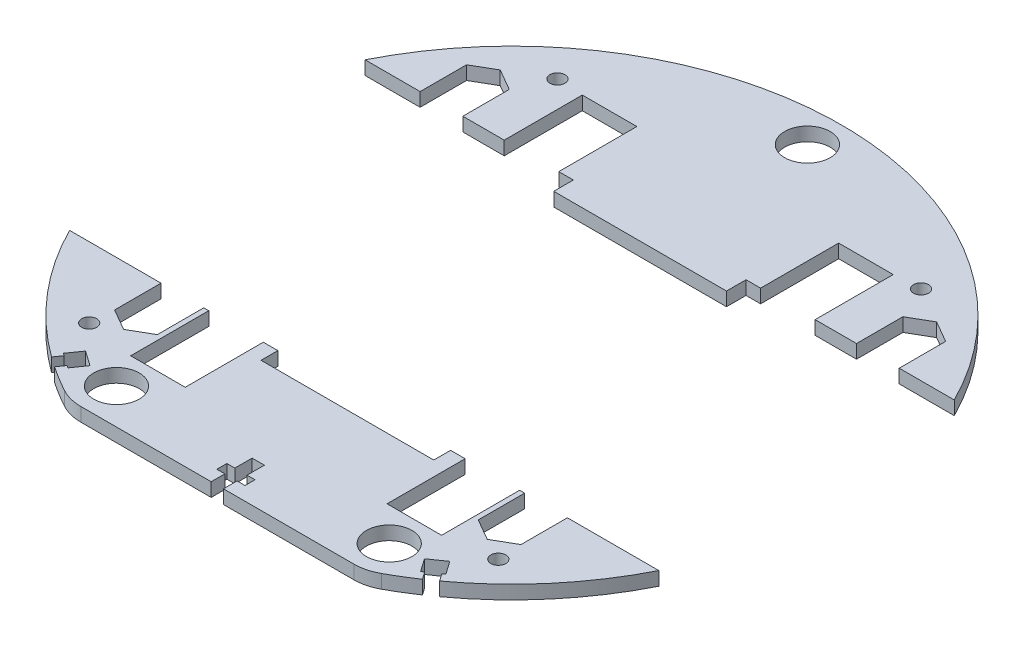
from build123d import *

# Parameters (mm, degrees)
BOSS_EXTRUDE1_DEPTH = 3
CUT_EXTRUDE1_DEPTH  = 103.574363269
SKETCH3_W           = 38.3
SKETCH3_H           = 65
CUT_EXTRUDE2_DEPTH  = 103.574363269
SKETCH4_R           = 5
CUT_EXTRUDE3_DEPTH  = 98.289516393
CUT_EXTRUDE4_DEPTH  = 98.289516393
SKETCH7_R           = 5
CUT_EXTRUDE6_DEPTH  = 98.289516393
CUT_EXTRUDE7_DEPTH  = 98.289516393
SKETCH9_R           = 1.65
CUT_EXTRUDE8_DEPTH  = 98.289516393
CUT_EXTRUDE9_DEPTH  = 98.289516393


with BuildPart() as part:
    # Sketch1 → Boss-Extrude1 (new body)
    with BuildSketch(Plane(origin=(0, 0, 0), x_dir=(1, 0, 0), z_dir=(0, 1, 0))):
        with BuildLine():
            Line((-30.029977361, -64.812867647), (30.029977361, -64.812867647))
            ThreePointArc((30.029977361, -64.812867647), (32.509837414, -64.500503794), (34.834773739, -63.582926471))
            ThreePointArc((34.834773739, -63.582926471), (0, 72.5), (-34.834773739, -63.582926471))
            ThreePointArc((-34.834773739, -63.582926471), (-32.509837414, -64.500503794), (-30.029977361, -64.812867647))
        make_face()
    extrude(amount=BOSS_EXTRUDE1_DEPTH)

    # Sketch2 → Cut-Extrude1 (cut, through all)
    with BuildSketch(Plane(origin=(0, 3, 0), x_dir=(1, 0, 0), z_dir=(0, 1, 0))):
        Polygon((-34.2, 49.675685802), (-34.2, -49.675685802), (-22.2, -49.675685802), (-22.2, -32.5), (-19, -32.5), (-19, -36.2), (-18, -36.2), (18, -36.2), (19, -36.2), (19, -32.5), (22.2, -32.5), (22.2, -49.675685802), (34.2, -49.675685802), (34.2, 49.675685802), (22.2, 49.675685802), (22.2, 32.5), (19, 32.5), (19, 28.2), (-19, 28.2), (-19, 32.5), (-22.2, 32.5), (-22.2, 49.675685802), align=None)
    extrude(amount=-CUT_EXTRUDE1_DEPTH, mode=Mode.SUBTRACT)

    # Sketch3 → Cut-Extrude2 (cut, through all)
    with BuildSketch(Plane(origin=(0, 3, 0), x_dir=(1, 0, 0), z_dir=(0, 1, 0))):
        with Locations((-53.35, 0)):
            Rectangle(SKETCH3_W, SKETCH3_H)
        with Locations((53.35, 0)):
            Rectangle(SKETCH3_W, SKETCH3_H)
    extrude(amount=-CUT_EXTRUDE2_DEPTH, mode=Mode.SUBTRACT)


with BuildPart() as cut_extrude2_piece_1:
    # of the separate pieces the step leaves, piece 1, a body of its own (cut_extrude2_pieces)
    add(part.part.solids().sort_by_distance((64.807406984, 0, -32.5))[0])


with BuildPart() as cut_extrude2_piece_2:
    # of the separate pieces the step leaves, piece 2, a body of its own (cut_extrude2_pieces)
    add(part.part.solids().sort_by_distance((-34.834773739, 0, 63.582926471))[0])

    # Sketch4 → Cut-Extrude3 (cut, through all)
    with BuildSketch(Plane(origin=(0, 3, 0), x_dir=(1, 0, 0), z_dir=(0, 1, 0))):
        with Locations((30, -57)):
            Circle(SKETCH4_R)
        with Locations((-30, -57)):
            Circle(SKETCH4_R)
    extrude(amount=-CUT_EXTRUDE3_DEPTH, mode=Mode.SUBTRACT)


with BuildPart() as cut_extrude4_tool:
    # Sketch5 → Cut-Extrude4 (new, through all)
    with BuildSketch(Plane(origin=(0, 3, 0), x_dir=(1, 0, 0), z_dir=(0, 1, 0))):
        Polygon((-52.7, 37.286453735), (-52.7, 32.5), (-43.3, 32.5), (-43.3, 37.286453735), (-43.3, 42.713546265), (-48, 45.42709253), (-52.7, 42.713546265), align=None)
        Polygon((-44.7, -37.286453735), (-44.7, -32.5), (-35.3, -32.5), (-35.3, -37.286453735), (-35.3, -42.713546265), (-40, -45.42709253), (-44.7, -42.713546265), align=None)
        Polygon((35.3, -32.5), (44.7, -32.5), (44.7, -37.286453735), (44.7, -42.713546265), (40, -45.42709253), (35.3, -42.713546265), (35.3, -37.286453735), align=None)
        Polygon((43.3, 37.286453735), (43.3, 42.713546265), (48, 45.42709253), (52.7, 42.713546265), (52.7, 37.286453735), (52.7, 32.5), (43.3, 32.5), align=None)
    extrude(amount=-CUT_EXTRUDE4_DEPTH)


with BuildPart() as cut_extrude2_piece_1_1:
    add(cut_extrude2_piece_1.part)

    # Cut-Extrude4: cut by cut_extrude4_tool
    add(cut_extrude4_tool.part, mode=Mode.SUBTRACT)

    # Sketch7 → Cut-Extrude6 (cut, through all)
    with BuildSketch(Plane(origin=(0, 3, 0), x_dir=(1, 0, 0), z_dir=(0, 1, 0))):
        with Locations((0, 65)):
            Circle(SKETCH7_R)
    extrude(amount=-CUT_EXTRUDE6_DEPTH, mode=Mode.SUBTRACT)


with BuildPart() as cut_extrude2_piece_2_1:
    add(cut_extrude2_piece_2.part)

    # Cut-Extrude4: cut by cut_extrude4_tool
    add(cut_extrude4_tool.part, mode=Mode.SUBTRACT)

    # Sketch8 → Cut-Extrude7 (cut, through all)
    with BuildSketch(Plane(origin=(0, 3, 0), x_dir=(1, 0, 0), z_dir=(0, 1, 0))):
        Polygon((-1.35, -64.812867647), (-1.35, -61.812867647), (-3.1, -61.812867647), (-3.1, -59.612867647), (-1.35, -59.612867647), (-1.35, -55.812867647), (1.35, -55.812867647), (1.35, -59.612867647), (3.1, -59.612867647), (3.1, -61.812867647), (1.35, -61.812867647), (1.35, -64.812867647), align=None)
    extrude(amount=-CUT_EXTRUDE7_DEPTH, mode=Mode.SUBTRACT)


with BuildPart() as cut_extrude8_tool:
    # Sketch9 → Cut-Extrude8 (new, through all)
    with BuildSketch(Plane(origin=(0, 3, 0), x_dir=(1, 0, 0), z_dir=(0, 1, 0))):
        with Locations((45, -48)):
            Circle(SKETCH9_R)
        with Locations((-45, -48)):
            Circle(SKETCH9_R)
        with Locations((40, 50)):
            Circle(SKETCH9_R)
        with Locations((-40, 50)):
            Circle(SKETCH9_R)
    extrude(amount=-CUT_EXTRUDE8_DEPTH)


with BuildPart() as cut_extrude2_piece_1_2:
    add(cut_extrude2_piece_1_1.part)

    # Cut-Extrude8: cut by cut_extrude8_tool
    add(cut_extrude8_tool.part, mode=Mode.SUBTRACT)


with BuildPart() as cut_extrude2_piece_2_2:
    add(cut_extrude2_piece_2_1.part)

    # Cut-Extrude8: cut by cut_extrude8_tool
    add(cut_extrude8_tool.part, mode=Mode.SUBTRACT)

    # Sketch10 → Cut-Extrude9 (cut, through all)
    with BuildSketch(Plane(origin=(0, 3, 0), x_dir=(1, 0, 0), z_dir=(0, 1, 0))):
        Polygon((36.791317147, -56.03033984), (40.067925324, -53.736034095), (42.075442851, -56.60306625), (41.542994023, -56.975890933), (42.690146895, -58.614195022), (40.478436376, -60.1628514), (39.331283503, -58.524547311), (38.798834674, -58.897371995), align=None)
        Polygon((-41.542994023, -56.975890933), (-42.075442851, -56.60306625), (-40.067925324, -53.736034095), (-36.791317147, -56.03033984), (-38.798834674, -58.897371995), (-39.331283503, -58.524547311), (-40.478436376, -60.1628514), (-42.690146895, -58.614195022), align=None)
    extrude(amount=-CUT_EXTRUDE9_DEPTH, mode=Mode.SUBTRACT)


solid = Compound([cut_extrude2_piece_1_2.part, cut_extrude2_piece_2_2.part])
